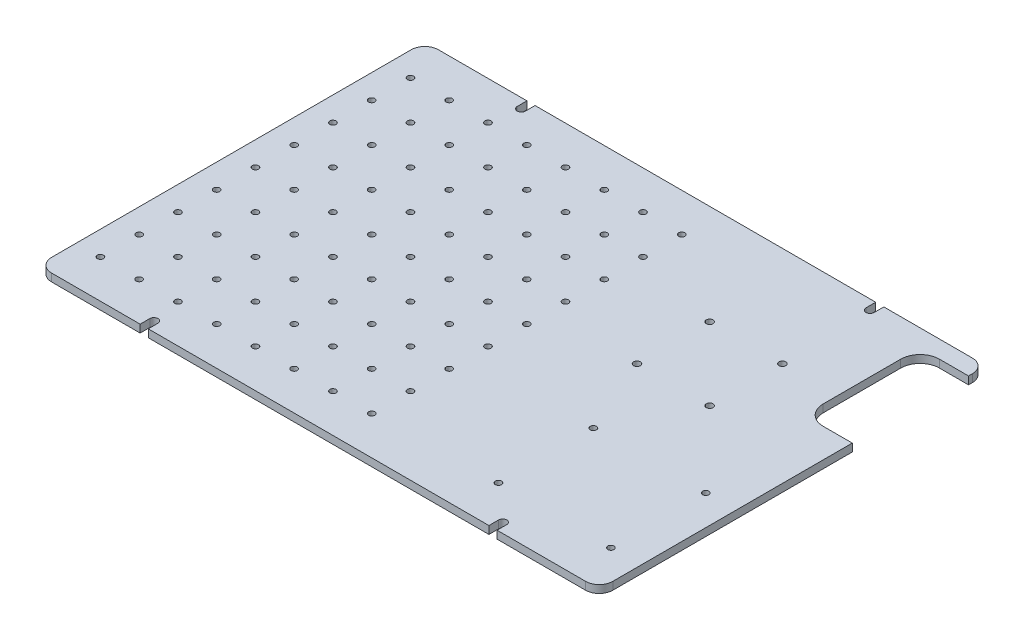
from build123d import *

# Parameters (mm, degrees)
SKETCH1_W           = 289.6
SKETCH1_H           = 199.6
BOSS_EXTRUDE1_DEPTH = 4
CUT_EXTRUDE1_DEPTH  = 176.906452412
FILLET1_R           = 7
SKETCH3_W           = 25
SKETCH3_H           = 60
CUT_EXTRUDE2_DEPTH  = 176.906452412
FILLET2_R           = 10
SKETCH4_R           = 1.6
CUT_EXTRUDE3_DEPTH  = 176.906452412
SKETCH5_R           = 1.75
CUT_EXTRUDE4_DEPTH  = 176.906452412
SKETCH6_R           = 1.59
CUT_EXTRUDE5_DEPTH  = 176.906452412


with BuildPart() as part:
    # Sketch1 → Boss-Extrude1 (new body)
    with BuildSketch(Plane(origin=(0, 0, 0), x_dir=(1, 0, 0), z_dir=(0, 1, 0))):
        Rectangle(SKETCH1_W, SKETCH1_H)
    extrude(amount=BOSS_EXTRUDE1_DEPTH)

    # Sketch2 → Cut-Extrude1 (cut, through all)
    with BuildSketch(Plane(origin=(0, 4, 0), x_dir=(1, 0, 0), z_dir=(0, 1, 0))):
        with BuildLine():
            Line((-87.9, 104.8), (-87.9, 94.8))
            ThreePointArc((-87.9, 94.8), (-90, 92.7), (-92.1, 94.8))
            Line((-92.1, 94.8), (-92.1, 104.8))
            ThreePointArc((-92.1, 104.8), (-90, 106.9), (-87.9, 104.8))
        make_face()
        with BuildLine():
            Line((92.1, 104.8), (92.1, 94.8))
            ThreePointArc((92.1, 94.8), (90, 92.7), (87.9, 94.8))
            Line((87.9, 94.8), (87.9, 104.8))
            ThreePointArc((87.9, 104.8), (90, 106.9), (92.1, 104.8))
        make_face()
    cut_extrude1 = extrude(amount=-CUT_EXTRUDE1_DEPTH, mode=Mode.SUBTRACT)

    # Mirror1: Cut-Extrude1 across plane
    add(cut_extrude1.mirror(Plane.XY), mode=Mode.SUBTRACT)

    # Fillet1
    fillet1_edges = [part.edges().sort_by_distance(p)[0] for p in [
        (144.8, 2, -99.8),
        (144.8, 2, 99.8),
        (-144.8, 2, 99.8),
        (-144.8, 2, -99.8),
    ]]
    fillet(fillet1_edges, radius=FILLET1_R)

    # Sketch3 → Cut-Extrude2 (cut, through all)
    with BuildSketch(Plane(origin=(0, 4, 0), x_dir=(1, 0, 0), z_dir=(0, 1, 0))):
        with Locations((132.3, 60.8)):
            Rectangle(SKETCH3_W, SKETCH3_H)
    extrude(amount=-CUT_EXTRUDE2_DEPTH, mode=Mode.SUBTRACT)

    # Fillet2
    fillet2_edges = [part.edges().sort_by_distance(p)[0] for p in [
        (119.8, 2, -30.8),
        (119.8, 2, -90.8),
    ]]
    fillet(fillet2_edges, radius=FILLET2_R)

    # Sketch4 → Cut-Extrude3 (cut, through all)
    with BuildSketch(Plane(origin=(0, 4, 0), x_dir=(1, 0, 0), z_dir=(0, 1, 0))):
        with Locations((129.3, -78.3)):
            Circle(SKETCH4_R)
        with Locations((71.3, -78.3)):
            Circle(SKETCH4_R)
        with Locations((129.3, -29.3)):
            Circle(SKETCH4_R)
        with Locations((71.3, -29.3)):
            Circle(SKETCH4_R)
    extrude(amount=-CUT_EXTRUDE3_DEPTH, mode=Mode.SUBTRACT)

    # Sketch5 → Cut-Extrude4 (cut, through all)
    with BuildSketch(Plane(origin=(0, 4, 0), x_dir=(1, 0, 0), z_dir=(0, 1, 0))):
        with Locations((91.3, 10.7)):
            Circle(SKETCH5_R)
        with Locations((91.3, 48.2)):
            Circle(SKETCH5_R)
        with Locations((53.8, 48.2)):
            Circle(SKETCH5_R)
        with Locations((53.8, 10.7)):
            Circle(SKETCH5_R)
    extrude(amount=-CUT_EXTRUDE4_DEPTH, mode=Mode.SUBTRACT)

    # Sketch6 → Cut-Extrude5 (cut, through all)
    with BuildSketch(Plane(origin=(0, 4, 0), x_dir=(1, 0, 0), z_dir=(0, 1, 0))):
        with Locations((7.6, 80)):
            Circle(SKETCH6_R)
        with Locations((-12.4, 80)):
            Circle(SKETCH6_R)
        with Locations((-32.4, 80)):
            Circle(SKETCH6_R)
        with Locations((-52.4, 80)):
            Circle(SKETCH6_R)
        with Locations((-72.4, 80)):
            Circle(SKETCH6_R)
        with Locations((-92.4, 80)):
            Circle(SKETCH6_R)
        with Locations((-112.4, 80)):
            Circle(SKETCH6_R)
        with Locations((-12.4, 60)):
            Circle(SKETCH6_R)
        with Locations((-32.4, 60)):
            Circle(SKETCH6_R)
        with Locations((-52.4, 60)):
            Circle(SKETCH6_R)
        with Locations((-72.4, 60)):
            Circle(SKETCH6_R)
        with Locations((-92.4, 60)):
            Circle(SKETCH6_R)
        with Locations((-112.4, 60)):
            Circle(SKETCH6_R)
        with Locations((-12.4, 40)):
            Circle(SKETCH6_R)
        with Locations((-32.4, 40)):
            Circle(SKETCH6_R)
        with Locations((-52.4, 40)):
            Circle(SKETCH6_R)
        with Locations((-72.4, 40)):
            Circle(SKETCH6_R)
        with Locations((-92.4, 40)):
            Circle(SKETCH6_R)
        with Locations((-112.4, 40)):
            Circle(SKETCH6_R)
        with Locations((-12.4, 20)):
            Circle(SKETCH6_R)
        with Locations((-32.4, 20)):
            Circle(SKETCH6_R)
        with Locations((-52.4, 20)):
            Circle(SKETCH6_R)
        with Locations((-72.4, 20)):
            Circle(SKETCH6_R)
        with Locations((-92.4, 20)):
            Circle(SKETCH6_R)
        with Locations((-112.4, 20)):
            Circle(SKETCH6_R)
        with Locations((-12.4, 0)):
            Circle(SKETCH6_R)
        with Locations((-32.4, 0)):
            Circle(SKETCH6_R)
        with Locations((-52.4, 0)):
            Circle(SKETCH6_R)
        with Locations((-72.4, 0)):
            Circle(SKETCH6_R)
        with Locations((-92.4, 0)):
            Circle(SKETCH6_R)
        with Locations((-112.4, 0)):
            Circle(SKETCH6_R)
        with Locations((-12.4, -20)):
            Circle(SKETCH6_R)
        with Locations((-32.4, -20)):
            Circle(SKETCH6_R)
        with Locations((-52.4, -20)):
            Circle(SKETCH6_R)
        with Locations((-72.4, -20)):
            Circle(SKETCH6_R)
        with Locations((-92.4, -20)):
            Circle(SKETCH6_R)
        with Locations((-112.4, -20)):
            Circle(SKETCH6_R)
        with Locations((-12.4, -40)):
            Circle(SKETCH6_R)
        with Locations((-32.4, -40)):
            Circle(SKETCH6_R)
        with Locations((-52.4, -40)):
            Circle(SKETCH6_R)
        with Locations((-72.4, -40)):
            Circle(SKETCH6_R)
        with Locations((-92.4, -40)):
            Circle(SKETCH6_R)
        with Locations((-112.4, -40)):
            Circle(SKETCH6_R)
        with Locations((-12.4, -60)):
            Circle(SKETCH6_R)
        with Locations((-32.4, -60)):
            Circle(SKETCH6_R)
        with Locations((-52.4, -60)):
            Circle(SKETCH6_R)
        with Locations((-72.4, -60)):
            Circle(SKETCH6_R)
        with Locations((-92.4, -60)):
            Circle(SKETCH6_R)
        with Locations((-112.4, -60)):
            Circle(SKETCH6_R)
        with Locations((-12.4, -80)):
            Circle(SKETCH6_R)
        with Locations((-32.4, -80)):
            Circle(SKETCH6_R)
        with Locations((-52.4, -80)):
            Circle(SKETCH6_R)
        with Locations((-72.4, -80)):
            Circle(SKETCH6_R)
        with Locations((-92.4, -80)):
            Circle(SKETCH6_R)
        with Locations((-112.4, -80)):
            Circle(SKETCH6_R)
        with Locations((7.6, 60)):
            Circle(SKETCH6_R)
        with Locations((7.6, 40)):
            Circle(SKETCH6_R)
        with Locations((7.6, 20)):
            Circle(SKETCH6_R)
        with Locations((7.6, 0)):
            Circle(SKETCH6_R)
        with Locations((7.6, -20)):
            Circle(SKETCH6_R)
        with Locations((7.6, -40)):
            Circle(SKETCH6_R)
        with Locations((7.6, -60)):
            Circle(SKETCH6_R)
        with Locations((7.6, -80)):
            Circle(SKETCH6_R)
        with Locations((-132.4, 80)):
            Circle(SKETCH6_R)
        with Locations((-132.4, 60)):
            Circle(SKETCH6_R)
        with Locations((-132.4, 40)):
            Circle(SKETCH6_R)
        with Locations((-132.4, 20)):
            Circle(SKETCH6_R)
        with Locations((-132.4, 0)):
            Circle(SKETCH6_R)
        with Locations((-132.4, -20)):
            Circle(SKETCH6_R)
        with Locations((-132.4, -40)):
            Circle(SKETCH6_R)
        with Locations((-132.4, -60)):
            Circle(SKETCH6_R)
        with Locations((-132.4, -80)):
            Circle(SKETCH6_R)
    extrude(amount=-CUT_EXTRUDE5_DEPTH, mode=Mode.SUBTRACT)


solid = part.part
